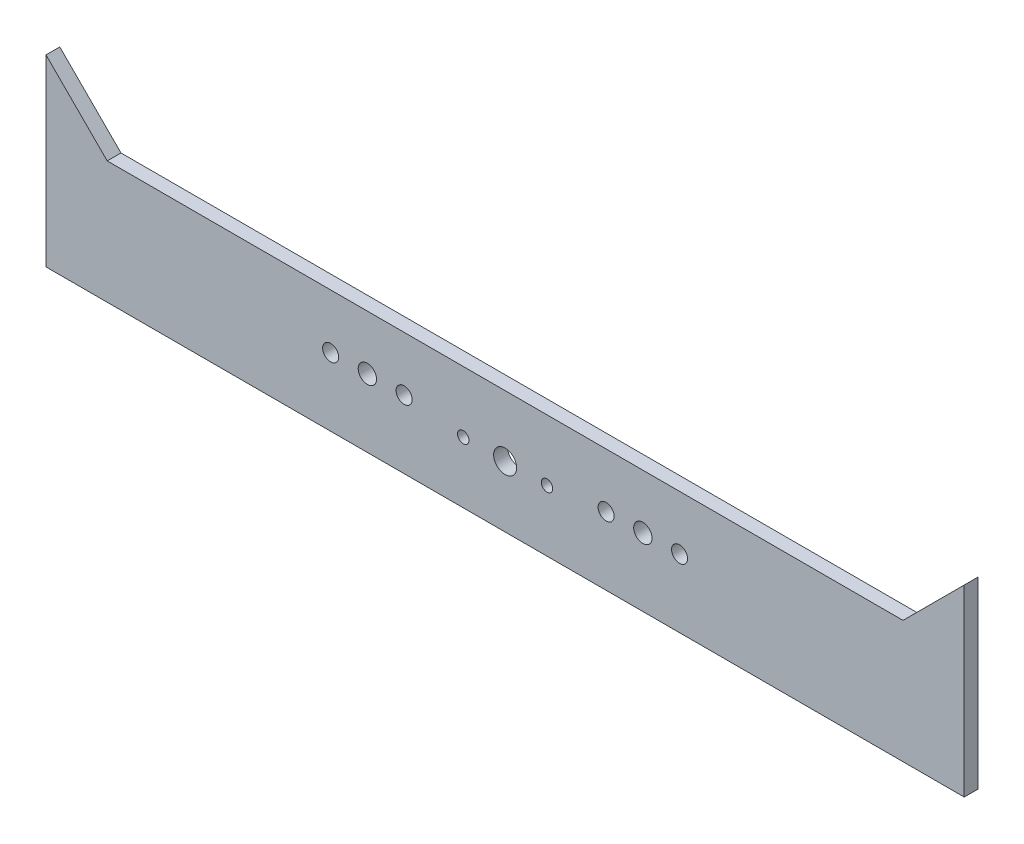
from build123d import *

# Parameters (mm, degrees)
BOSS_EXTRUDE1_DEPTH = 6
SKETCH2_R           = 5
SKETCH2_R_2         = 4
SKETCH2_R_3         = 3.5
SKETCH2_R_4         = 2.5
CUT_EXTRUDE1_DEPTH  = 216.490138986


with BuildPart() as part:
    # Sketch1 → Boss-Extrude1 (new body)
    with BuildSketch(Plane.XY):
        Polygon((-200, 0), (200, 0), (200, 80), (173.333333333, 53.333333333), (-173.333333333, 53.333333333), (-200, 80), align=None)
    extrude(amount=BOSS_EXTRUDE1_DEPTH)

    # Sketch2 → Cut-Extrude1 (cut, through all)
    with BuildSketch(Plane.XY.offset(6)):
        with Locations((0, 26.665)):
            Circle(SKETCH2_R)
        with Locations((60, 29.665)):
            Circle(SKETCH2_R_2)
        with Locations((76, 29.665)):
            Circle(SKETCH2_R_3)
        with Locations((44, 29.665)):
            Circle(SKETCH2_R_3)
        with Locations((-44, 29.665)):
            Circle(SKETCH2_R_3)
        with Locations((-76, 29.665)):
            Circle(SKETCH2_R_3)
        with Locations((-60, 29.665)):
            Circle(SKETCH2_R_2)
        with Locations((18.25, 26.665)):
            Circle(SKETCH2_R_4)
        with Locations((-18.25, 26.665)):
            Circle(SKETCH2_R_4)
    extrude(amount=-CUT_EXTRUDE1_DEPTH, mode=Mode.SUBTRACT)


solid = part.part
